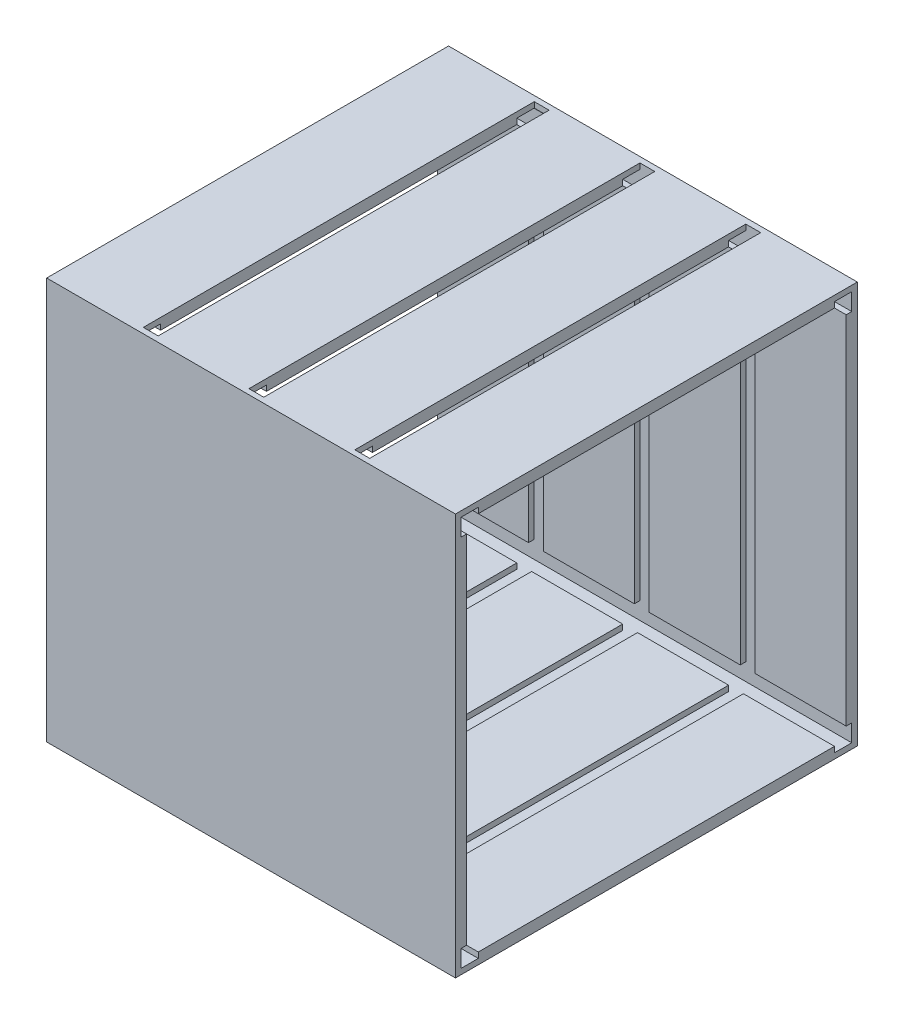
from build123d import *

# Parameters (mm, degrees)
SKETCH1_W            = 688.1
SKETCH1_H            = 688.1
SKETCH1_W_2          = 650
SKETCH1_H_2          = 650
BOSS_EXTRUDE1_DEPTH  = 700
SKETCH3_W            = 25.4
SKETCH3_H            = 650
CUT_EXTRUDE1_DEPTH   = 9.525
SKETCH4_W            = 25.4
SKETCH4_H            = 669.5
SKETCH4_H_2          = 669.05
CUT_EXTRUDE3_DEPTH   = 9.525
SKETCH6_W            = 25.4
SKETCH6_H            = 669.5
CUT_EXTRUDE4_DEPTH   = 9.525
CUT_EXTRUDE5_DEPTH   = 700
MIRROR6_COPY_1_DEPTH = 700
MIRROR6_COPY_2_DEPTH = 700


with BuildPart() as part:
    # Sketch1 → Boss-Extrude1 (new body)
    with BuildSketch(Plane(origin=(0, 0, 0), x_dir=(0, 0, -1), z_dir=(1, 0, 0))):
        with Locations((344.05, 344.05)):
            Rectangle(SKETCH1_W, SKETCH1_H)
        with Locations((344.05, 344.05)):
            Rectangle(SKETCH1_W_2, SKETCH1_H_2, mode=Mode.SUBTRACT)
    extrude(amount=BOSS_EXTRUDE1_DEPTH)

    # Sketch3 → Cut-Extrude1 (cut)
    with BuildSketch(Plane.XY.offset(-669.05)):
        with Locations((168.65, 344.05)):
            Rectangle(SKETCH3_W, SKETCH3_H)
        with Locations((350, 344.05)):
            Rectangle(SKETCH3_W, SKETCH3_H)
        with Locations((531.35, 344.05)):
            Rectangle(SKETCH3_W, SKETCH3_H)
    cut_extrude1 = extrude(amount=-CUT_EXTRUDE1_DEPTH, mode=Mode.SUBTRACT)

    # Mirror2: Cut-Extrude1 across plane
    add(cut_extrude1.mirror(Plane(origin=(0, 0, -344.05), x_dir=(1, 0, 0), z_dir=(0, 0, -1))), mode=Mode.SUBTRACT)

    # Sketch4 → Cut-Extrude3 (cut)
    with BuildSketch(Plane(origin=(0, 19.05, 0), x_dir=(1, 0, 0), z_dir=(0, 1, 0))):
        with Locations((168.65, 343.825)):
            Rectangle(SKETCH4_W, SKETCH4_H)
        with Locations((350, 343.825)):
            Rectangle(SKETCH4_W, SKETCH4_H)
        with Locations((531.35, 344.05)):
            Rectangle(SKETCH4_W, SKETCH4_H_2)
    cut_extrude3 = extrude(amount=-CUT_EXTRUDE3_DEPTH, mode=Mode.SUBTRACT)

    # Mirror4: Cut-Extrude3 across plane
    add(cut_extrude3.mirror(Plane.ZX.offset(344.05)), mode=Mode.SUBTRACT)

    # Sketch6 → Cut-Extrude4 (cut)
    with BuildSketch(Plane(origin=(0, 688.1, 0), x_dir=(1, 0, 0), z_dir=(0, 1, 0))):
        with Locations((168.65, 344.275)):
            Rectangle(SKETCH6_W, SKETCH6_H)
        with Locations((350, 343.825)):
            Rectangle(SKETCH6_W, SKETCH6_H)
        with Locations((531.35, 343.825)):
            Rectangle(SKETCH6_W, SKETCH6_H)
    extrude(amount=-CUT_EXTRUDE4_DEPTH, mode=Mode.SUBTRACT)

    # Sketch7 → Cut-Extrude5 (cut)
    with BuildSketch(Plane.ZY):
        Polygon((-19.05, 39.05), (-9.525, 39.05), (-9.525, 9.525), (-39.05, 9.525), (-39.05, 19.05), (-19.05, 19.05), align=None)
    cut_extrude5 = extrude(amount=-CUT_EXTRUDE5_DEPTH, mode=Mode.SUBTRACT)

    # Mirror5: Cut-Extrude5 across plane
    add(cut_extrude5.mirror(Plane(origin=(0, 0, -344.05), x_dir=(1, 0, 0), z_dir=(0, 0, -1))), mode=Mode.SUBTRACT)

    # Mirror6 copy 1 sketch → Mirror6 copy 1 (cut)
    with BuildSketch(Plane(origin=(0, 688.1, -688.1), x_dir=(0, 0, -1), z_dir=(-1, 0, 0))):
        Polygon((-19.05, 39.05), (-9.525, 39.05), (-9.525, 9.525), (-39.05, 9.525), (-39.05, 19.05), (-19.05, 19.05), align=None)
    extrude(amount=-MIRROR6_COPY_1_DEPTH, mode=Mode.SUBTRACT)

    # Mirror6 copy 2 sketch → Mirror6 copy 2 (cut)
    with BuildSketch(Plane(origin=(0, 688.1, 0), x_dir=(0, 0, 1), z_dir=(-1, 0, 0))):
        Polygon((-19.05, -39.05), (-9.525, -39.05), (-9.525, -9.525), (-39.05, -9.525), (-39.05, -19.05), (-19.05, -19.05), align=None)
    extrude(amount=-MIRROR6_COPY_2_DEPTH, mode=Mode.SUBTRACT)


solid = part.part
